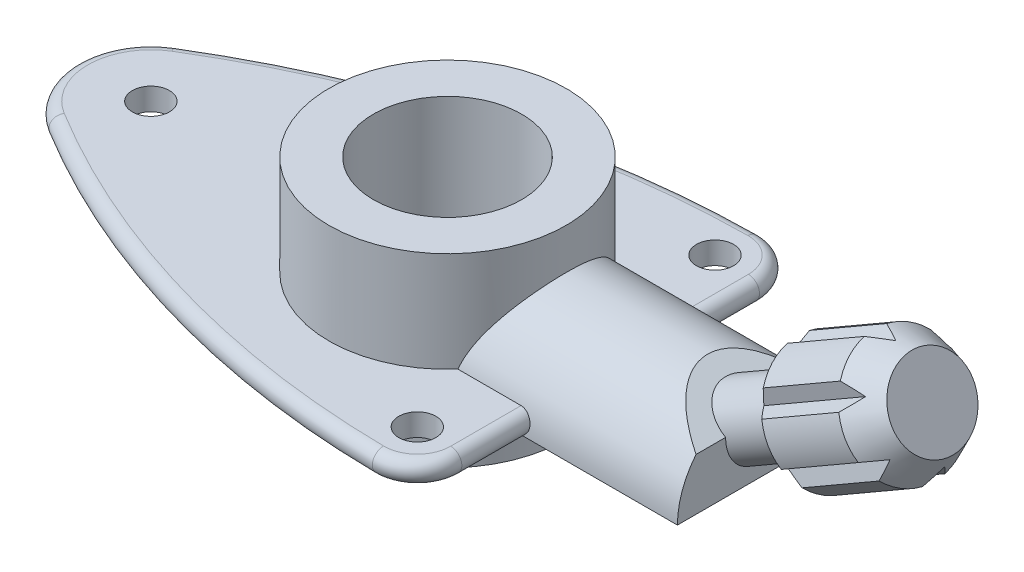
from build123d import *

# Parameters (mm, degrees)
SKETCH_5_R                                 = 2.5
SKETCH_5_R_2                               = 16
EXTRUDE_4_DEPTH                            = 1.5
EXTRUDE_5_DEPTH                            = 15
EXTRUDE_5_DEPTH_BACK                       = 10
SKETCH_5_5_R                               = 16
SKETCH_5_5_R_2                             = 10
EXTRUDE_8_REACH                            = 102.349
EXTRUDE_8_END_RADIUS                       = 16
EXTRUDE_START                              = 42
FILLET_3_R                                 = 1.5
CUT_EXTRUDE_1_DEPTH                        = 59.349404868
CUT_EXTRUDE_1_DEPTH_BACK                   = 59.349404868
SKETCH_12_R                                = 4.5
EXTRUDE_10_DEPTH                           = 27
EXTRUDE_10_DIRECTION_2_REACH               = 95.68
EXTRUDE_10_DIRECTION_2_OFFSET_FROM_SURFACE = 1
CUT_EXTRUDE_2_REACH                        = 120.489


with BuildPart() as part:
    # 草图5 → 凸台-拉伸4 (new, symmetric)
    with BuildSketch(Plane(origin=(0, 0, 0), x_dir=(1, 0, 0), z_dir=(0, 1, 0))):
        with BuildLine():
            Line((22, 12.901198358), (22, 20.070155931))
            ThreePointArc((22, 20.070155931), (20.219165167, 24.336142956), (15.933784902, 26.06979055))
            ThreePointArc((15.933784902, 26.06979055), (-15.818395827, 21.428501684), (-45.205280625, 8.538445621))
            ThreePointArc((-45.205280625, 8.538445621), (-50, 0), (-45.205280625, -8.538445621))
            ThreePointArc((-45.205280625, -8.538445621), (-15.818395827, -21.428501684), (15.933784902, -26.06979055))
            ThreePointArc((15.933784902, -26.06979055), (20.219165167, -24.336142956), (22, -20.070155931))
            Line((22, -20.070155931), (22, -12.901198358))
            Line((22, -12.901198358), (22, 12.901198358))
        make_face()
        with Locations(Location((-40, 0, 0), (0, 0, 270))):
            Circle(SKETCH_5_R, mode=Mode.SUBTRACT)
        with Locations(Location((16, -20.070155931, 0), (0, 0, 270))):
            Circle(SKETCH_5_R, mode=Mode.SUBTRACT)
        with Locations(Location((0, 0, 0), (0, 0, 270))):
            Circle(SKETCH_5_R_2, mode=Mode.SUBTRACT)
        with Locations(Location((16, 20.070155931, 0), (0, 0, 270))):
            Circle(SKETCH_5_R, mode=Mode.SUBTRACT)
    extrude(amount=EXTRUDE_4_DEPTH, both=True)

    # 草图5<5> → 凸台-拉伸5 (add, two sides: drawn at the far end of the back side and taken through both)
    with BuildSketch(Plane(origin=(0, 0, 0), x_dir=(1, 0, 0), z_dir=(0, 1, 0)).offset(-EXTRUDE_5_DEPTH_BACK)):
        with Locations(Location((0, 0, 0), (0, 0, 270))):
            Circle(SKETCH_5_5_R)
        with Locations(Location((0, 0, 0), (0, 0, 270))):
            Circle(SKETCH_5_5_R_2, mode=Mode.SUBTRACT)
    extrude(amount=EXTRUDE_5_DEPTH + EXTRUDE_5_DEPTH_BACK)

    # 凸台-拉伸8: up to this cylinder (the profile starts outside it)
    extrude_8_end = Plane(origin=(0, 3.168545, 0), z_dir=(0, -1, 0)) * Cylinder(EXTRUDE_8_END_RADIUS, 237.698, mode=Mode.PRIVATE)
    # 草图7 → 凸台-拉伸8 (add, up to the surface)
    with BuildSketch(Plane(origin=(0, 0, 0), x_dir=(0, 0, -1), z_dir=(1, 0, 0)).offset(EXTRUDE_START), mode=Mode.PRIVATE) as extrude_8_sk1:
        with BuildLine():
            ThreePointArc((11, -1.5), (7.778174593, 6.278174593), (0, 9.5))
            Line((0, 9.5), (0, -1.5))
            Line((0, -1.5), (11, -1.5))
        make_face()
    extrude_8_tool1 = extrude(extrude_8_sk1.sketch, amount=-EXTRUDE_8_REACH, mode=Mode.PRIVATE) - extrude_8_end
    add(extrude_8_tool1.solids().sort_by_distance((42, 3.168545, -4.668545))[0])
    # 草图7 → 凸台-拉伸8 (add, up to the surface)
    with BuildSketch(Plane(origin=(0, 0, 0), x_dir=(0, 0, -1), z_dir=(1, 0, 0)).offset(EXTRUDE_START), mode=Mode.PRIVATE) as extrude_8_sk2:
        with BuildLine():
            Line((0, -1.5), (0, 9.5))
            ThreePointArc((0, 9.5), (-7.778174593, 6.278174593), (-11, -1.5))
            Line((-11, -1.5), (0, -1.5))
        make_face()
    extrude_8_tool2 = extrude(extrude_8_sk2.sketch, amount=-EXTRUDE_8_REACH, mode=Mode.PRIVATE) - extrude_8_end
    add(extrude_8_tool2.solids().sort_by_distance((42, 3.168545, 4.668545))[0])
    # 草图7 → 凸台-拉伸8 (add, up to the surface)
    with BuildSketch(Plane(origin=(0, 0, 0), x_dir=(0, 0, -1), z_dir=(1, 0, 0)).offset(EXTRUDE_START), mode=Mode.PRIVATE) as extrude_8_sk3:
        with BuildLine():
            ThreePointArc((11, -1.5), (7.778174593, 6.278174593), (0, 9.5))
            Line((0, 9.5), (0, -1.5))
            Line((0, -1.5), (11, -1.5))
        make_face()
    extrude_8_tool3 = extrude(extrude_8_sk3.sketch, amount=-EXTRUDE_8_REACH, mode=Mode.PRIVATE) - extrude_8_end
    add(extrude_8_tool3.solids().sort_by_distance((42, 3.168545, -4.668545))[0])
    # 草图7 → 凸台-拉伸8 (add, up to the surface)
    with BuildSketch(Plane(origin=(0, 0, 0), x_dir=(0, 0, -1), z_dir=(1, 0, 0)).offset(EXTRUDE_START), mode=Mode.PRIVATE) as extrude_8_sk4:
        with BuildLine():
            Line((0, -1.5), (0, 9.5))
            ThreePointArc((0, 9.5), (-7.778174593, 6.278174593), (-11, -1.5))
            Line((-11, -1.5), (0, -1.5))
        make_face()
    extrude_8_tool4 = extrude(extrude_8_sk4.sketch, amount=-EXTRUDE_8_REACH, mode=Mode.PRIVATE) - extrude_8_end
    add(extrude_8_tool4.solids().sort_by_distance((42, 3.168545, 4.668545))[0])

    # 圆角3
    # the kernel refuses this fillet: 1.5 mm, written as the material it adds along each edge
    # the kernel refuses this fillet: 1.5 mm, written as the material it takes off along each edge
    with BuildSketch(Plane(origin=(16, -1.5, -20.070155931), x_dir=(1, 0, 0), z_dir=(0, 0, 1))) as fillet_3_2_piece_1:
        with BuildLine():
            CenterArc((6 - FILLET_3_R, FILLET_3_R), FILLET_3_R, 270, 90)
            Line((6 - FILLET_3_R, 0), (6, 0))
            Line((6, 0), (6, FILLET_3_R))
        make_face()
    revolve(axis=Axis((16, -1.5, -20.070155931), (0, 1, 0)), revolution_arc=90.632320449, mode=Mode.SUBTRACT)
    with BuildSketch(Plane(origin=(22, -1.5, 7.25), x_dir=(0, 1, 0), z_dir=(0, 0, 1))) as fillet_3_2_piece_2_section:
        with BuildLine():
            CenterArc((FILLET_3_R, FILLET_3_R), FILLET_3_R, 180, 90)
            Line((0, FILLET_3_R), (0, 0))
            Line((0, 0), (FILLET_3_R, 0))
        make_face()
    fillet_3_2_piece_2 = extrude(amount=12.820155931, mode=Mode.PRIVATE)
    fillet_3_2_piece_2 = fillet_3_2_piece_2 - Plane(origin=(21.695873308, -1.5, 0), x_dir=(0, 0, -1), z_dir=(1, 0, 0)) * Cylinder(11, 32, mode=Mode.PRIVATE)
    add(fillet_3_2_piece_2, mode=Mode.SUBTRACT)
    with BuildSketch(Plane(origin=(16, -1.5, 20.070155931), x_dir=(-0.0110358497416669, 0, 0.9999391031560269), z_dir=(-0.9999391031560269, 0, -0.0110358497416669))) as fillet_3_2_piece_3:
        with BuildLine():
            CenterArc((6 - FILLET_3_R, FILLET_3_R), FILLET_3_R, 270, 90)
            Line((6 - FILLET_3_R, 0), (6, 0))
            Line((6, 0), (6, FILLET_3_R))
        make_face()
    revolve(axis=Axis((16, -1.5, 20.070155931), (0, 1, 0)), revolution_arc=90.632320449, mode=Mode.SUBTRACT)
    with BuildSketch(Plane(origin=(17.258086871, -1.5, -93.922901829), x_dir=(-0.5205280624595463, 0, 0.8538445620791356), z_dir=(-0.8538445620791356, 0, -0.5205280624595463))) as fillet_3_2_piece_4:
        with BuildLine():
            CenterArc((120 - FILLET_3_R, FILLET_3_R), FILLET_3_R, 270, 90)
            Line((120 - FILLET_3_R, 0), (120, 0))
            Line((120, 0), (120, FILLET_3_R))
        make_face()
    revolve(axis=Axis((17.258086871, -1.5, -93.922901829), (0, 1, 0)), revolution_arc=30.735359102, mode=Mode.SUBTRACT)
    with BuildSketch(Plane(origin=(-40, -1.5, 0), x_dir=(-0.5205280624595499, 0, -0.8538445620791334), z_dir=(0.8538445620791334, 0, -0.5205280624595499))) as fillet_3_2_piece_5:
        with BuildLine():
            CenterArc((10 - FILLET_3_R, FILLET_3_R), FILLET_3_R, 270, 90)
            Line((10 - FILLET_3_R, 0), (10, 0))
            Line((10, 0), (10, FILLET_3_R))
        make_face()
    revolve(axis=Axis((-40, -1.5, 0), (0, 1, 0)), revolution_arc=117.264640898, mode=Mode.SUBTRACT)
    with BuildSketch(Plane(origin=(17.258086871, -1.5, 93.922901829), x_dir=(-0.011035849741673097, 0, -0.9999391031560269), z_dir=(0.9999391031560269, 0, -0.011035849741673097))) as fillet_3_2_piece_6:
        with BuildLine():
            CenterArc((120 - FILLET_3_R, FILLET_3_R), FILLET_3_R, 270, 90)
            Line((120 - FILLET_3_R, 0), (120, 0))
            Line((120, 0), (120, FILLET_3_R))
        make_face()
    revolve(axis=Axis((17.258086871, -1.5, 93.922901829), (0, 1, 0)), revolution_arc=30.735359102, mode=Mode.SUBTRACT)
    with BuildSketch(Plane(origin=(17.258086871, 1.5, 93.922901829), x_dir=(-0.011035849741673097, 0, -0.9999391031560269), z_dir=(0.9999391031560269, 0, -0.011035849741673097))) as fillet_3_2_piece_7:
        with BuildLine():
            CenterArc((120 - FILLET_3_R, -FILLET_3_R), FILLET_3_R, 0, 90)
            Line((120 - FILLET_3_R, 0), (120, 0))
            Line((120, 0), (120, -FILLET_3_R))
        make_face()
    revolve(axis=Axis((17.258086871, 1.5, 93.922901829), (0, 1, 0)), revolution_arc=30.735359102, mode=Mode.SUBTRACT)
    with BuildSketch(Plane(origin=(-40, 1.5, 0), x_dir=(-0.5205280624595499, 0, -0.8538445620791334), z_dir=(0.8538445620791334, 0, -0.5205280624595499))) as fillet_3_2_piece_8:
        with BuildLine():
            CenterArc((10 - FILLET_3_R, -FILLET_3_R), FILLET_3_R, 0, 90)
            Line((10 - FILLET_3_R, 0), (10, 0))
            Line((10, 0), (10, -FILLET_3_R))
        make_face()
    revolve(axis=Axis((-40, 1.5, 0), (0, 1, 0)), revolution_arc=117.264640898, mode=Mode.SUBTRACT)
    with BuildSketch(Plane(origin=(17.258086871, 1.5, -93.922901829), x_dir=(-0.5205280624595463, 0, 0.8538445620791356), z_dir=(-0.8538445620791356, 0, -0.5205280624595463))) as fillet_3_2_piece_9:
        with BuildLine():
            CenterArc((120 - FILLET_3_R, -FILLET_3_R), FILLET_3_R, 0, 90)
            Line((120, -FILLET_3_R), (120, 0))
            Line((120, 0), (120 - FILLET_3_R, 0))
        make_face()
    revolve(axis=Axis((17.258086871, 1.5, -93.922901829), (0, 1, 0)), revolution_arc=30.735359102, mode=Mode.SUBTRACT)
    with BuildSketch(Plane(origin=(22, -1.5, -20.070155931), x_dir=(0, 1, 0), z_dir=(0, 0, 1))) as fillet_3_2_piece_10_section:
        with BuildLine():
            CenterArc((FILLET_3_R, FILLET_3_R), FILLET_3_R, 180, 90)
            Line((0, FILLET_3_R), (0, 0))
            Line((0, 0), (FILLET_3_R, 0))
        make_face()
    fillet_3_2_piece_10 = extrude(amount=12.820155931, mode=Mode.PRIVATE)
    fillet_3_2_piece_10 = fillet_3_2_piece_10 - Plane(origin=(21.695873079, -1.5, 0), x_dir=(0, 0, -1), z_dir=(1, 0, 0)) * Cylinder(11, 32, mode=Mode.PRIVATE)
    add(fillet_3_2_piece_10, mode=Mode.SUBTRACT)
    with BuildSketch(Plane(origin=(22, 1.5, -6.833005244), x_dir=(0, -1, 0), z_dir=(0, 0, -1))) as fillet_3_2_piece_11_section:
        with BuildLine():
            CenterArc((FILLET_3_R, FILLET_3_R), FILLET_3_R, 180, 90)
            Line((0, FILLET_3_R), (0, 0))
            Line((0, 0), (FILLET_3_R, 0))
        make_face()
    fillet_3_2_piece_11 = extrude(amount=13.237150687, mode=Mode.PRIVATE)
    fillet_3_2_piece_11 = fillet_3_2_piece_11 - Plane(origin=(21.692857853, -1.5, 0), x_dir=(0, 0, -1), z_dir=(1, 0, 0)) * Cylinder(11, 33, mode=Mode.PRIVATE)
    add(fillet_3_2_piece_11, mode=Mode.SUBTRACT)
    with BuildSketch(Plane(origin=(16, 1.5, 20.070155931), x_dir=(-0.0110358497416669, 0, 0.9999391031560269), z_dir=(-0.9999391031560269, 0, -0.0110358497416669))) as fillet_3_2_piece_12:
        with BuildLine():
            CenterArc((6 - FILLET_3_R, -FILLET_3_R), FILLET_3_R, 0, 90)
            Line((6 - FILLET_3_R, 0), (6, 0))
            Line((6, 0), (6, -FILLET_3_R))
        make_face()
    revolve(axis=Axis((16, 1.5, 20.070155931), (0, 1, 0)), revolution_arc=90.632320449, mode=Mode.SUBTRACT)
    with BuildSketch(Plane(origin=(22, 1.5, 20.070155931), x_dir=(0, -1, 0), z_dir=(0, 0, -1))) as fillet_3_2_piece_13_section:
        with BuildLine():
            CenterArc((FILLET_3_R, FILLET_3_R), FILLET_3_R, 180, 90)
            Line((0, FILLET_3_R), (0, 0))
            Line((0, 0), (FILLET_3_R, 0))
        make_face()
    fillet_3_2_piece_13 = extrude(amount=13.237150687, mode=Mode.PRIVATE)
    fillet_3_2_piece_13 = fillet_3_2_piece_13 - Plane(origin=(21.692857203, -1.5, 0), x_dir=(0, 0, -1), z_dir=(1, 0, 0)) * Cylinder(11, 33, mode=Mode.PRIVATE)
    add(fillet_3_2_piece_13, mode=Mode.SUBTRACT)
    with BuildSketch(Plane(origin=(16, 1.5, -20.070155931), x_dir=(1, 0, 0), z_dir=(0, 0, 1))) as fillet_3_2_piece_14:
        with BuildLine():
            CenterArc((6 - FILLET_3_R, -FILLET_3_R), FILLET_3_R, 0, 90)
            Line((6 - FILLET_3_R, 0), (6, 0))
            Line((6, 0), (6, -FILLET_3_R))
        make_face()
    revolve(axis=Axis((16, 1.5, -20.070155931), (0, 1, 0)), revolution_arc=90.632320449, mode=Mode.SUBTRACT)

    # 草图10 → 切除-拉伸1 (cut, two sides: drawn at the far end of the back side and taken through both)
    with BuildSketch(Plane.XY.offset(-CUT_EXTRUDE_1_DEPTH_BACK)):
        Polygon((-135.182857094, 107.796570239), (35.07179677, 9.5), (42, 5.5), (212.254653864, -92.796570239), (408.847794342, 247.712737489), (61.410283384, 448.305877967), align=None)
    extrude(amount=CUT_EXTRUDE_1_DEPTH + CUT_EXTRUDE_1_DEPTH_BACK, mode=Mode.SUBTRACT)

    # 草图12 → 凸台-拉伸10 (add)
    with BuildSketch(Plane(origin=(33.88156986, 19.561533479, 0), x_dir=(0, 0, -1), z_dir=(0.8660254037844398, 0.499999999999998, 0))):
        with Locations(Location((0, -16.236860279, 0), (0, 0, 90))):
            Circle(SKETCH_12_R)
    extrude(amount=EXTRUDE_10_DEPTH)

    # 凸台-拉伸10 direction 2: up to this face of the body (flat: up to its plane, moved by the offset)
    extrude_10_direction_2_end = Plane(part.part.faces().sort_by_distance((19.47019321, -1.5, -15.535077966))[0]).offset(-EXTRUDE_10_DIRECTION_2_OFFSET_FROM_SURFACE)
    # 草图12 → 凸台-拉伸10 direction 2 (add, up to the picked face)
    with BuildSketch(Plane(origin=(33.88156986, 19.561533479, 0), x_dir=(0, 0, -1), z_dir=(0.8660254037844398, 0.499999999999998, 0)), mode=Mode.PRIVATE) as extrude_10_direction_2_sk1:
        with Locations(Location((0, -16.236860279, 0), (0, 0, 90))):
            Circle(SKETCH_12_R)
    extrude_10_direction_2_tool1 = split(extrude(extrude_10_direction_2_sk1.sketch, amount=-EXTRUDE_10_DIRECTION_2_REACH, mode=Mode.PRIVATE), bisect_by=extrude_10_direction_2_end, keep=Keep.BOTH, mode=Mode.PRIVATE)
    add(extrude_10_direction_2_tool1.solids().sort_by(Axis((42, 5.5, 0), (-0.8660254037844398, -0.499999999999998, 0)))[0])

    # 草图14 → 旋转1 (revolve)
    with BuildSketch(Plane.XY):
        Polygon((45.959292144, 12.982050808), (47.240381057, 17.763139721), (57.632685902, 23.763139721), (62.632685902, 23.763139721), (63.132685902, 22.897114317), align=None)
    revolve(axis=Axis((14.207613987, -10.545941546, 0), (0.8660254037844398, 0.49999999999999806, 0)))

    # 草图15 → 切除-拉伸2 (cut, up to next)
    with BuildSketch(Plane(origin=(57.264255763, 33.061533479, 0), x_dir=(0, 0, -1), z_dir=(0.8660254037844398, 0.49999999999999806, 0)), mode=Mode.PRIVATE) as cut_extrude_2_sk1:
        with BuildLine():
            Line((-1.5, -8.378743456), (0, -9.637392903))
            Line((0, -9.637392903), (1.5, -8.378743456))
            ThreePointArc((1.5, -8.378743456), (0, -8.236860279), (-1.5, -8.378743456))
        make_face()
    cut_extrude_2_tool1 = extrude(cut_extrude_2_sk1.sketch, amount=-CUT_EXTRUDE_2_REACH, mode=Mode.PRIVATE) & part.part
    # 草图15 → 切除-拉伸2 (cut, up to next)
    with BuildSketch(Plane(origin=(57.264255763, 33.061533479, 0), x_dir=(0, 0, -1), z_dir=(0.8660254037844398, 0.49999999999999806, 0)), mode=Mode.PRIVATE) as cut_extrude_2_sk2:
        with BuildLine():
            Line((5.715306399, -12.937126591), (7.555328794, -13.606839973))
            ThreePointArc((7.555328794, -13.606839973), (6.92820323, -12.236860279), (6.055328794, -11.008763762))
            Line((6.055328794, -11.008763762), (5.715306399, -12.937126591))
        make_face()
    cut_extrude_2_tool2 = extrude(cut_extrude_2_sk2.sketch, amount=-CUT_EXTRUDE_2_REACH, mode=Mode.PRIVATE) & part.part
    # 草图15 → 切除-拉伸2 (cut, up to next)
    with BuildSketch(Plane(origin=(57.264255763, 33.061533479, 0), x_dir=(0, 0, -1), z_dir=(0.8660254037844398, 0.49999999999999806, 0)), mode=Mode.PRIVATE) as cut_extrude_2_sk3:
        with BuildLine():
            Line((5.715306399, -19.536593967), (6.055328794, -21.464956796))
            ThreePointArc((6.055328794, -21.464956796), (6.92820323, -20.236860279), (7.555328794, -18.866880585))
            Line((7.555328794, -18.866880585), (5.715306399, -19.536593967))
        make_face()
    cut_extrude_2_tool3 = extrude(cut_extrude_2_sk3.sketch, amount=-CUT_EXTRUDE_2_REACH, mode=Mode.PRIVATE) & part.part
    # 草图15 → 切除-拉伸2 (cut, up to next)
    with BuildSketch(Plane(origin=(57.264255763, 33.061533479, 0), x_dir=(0, 0, -1), z_dir=(0.8660254037844398, 0.49999999999999806, 0)), mode=Mode.PRIVATE) as cut_extrude_2_sk4:
        with BuildLine():
            Line((0, -22.836327655), (-1.5, -24.094977102))
            ThreePointArc((-1.5, -24.094977102), (0, -24.236860279), (1.5, -24.094977102))
            Line((1.5, -24.094977102), (0, -22.836327655))
        make_face()
    cut_extrude_2_tool4 = extrude(cut_extrude_2_sk4.sketch, amount=-CUT_EXTRUDE_2_REACH, mode=Mode.PRIVATE) & part.part
    # 草图15 → 切除-拉伸2 (cut, up to next)
    with BuildSketch(Plane(origin=(57.264255763, 33.061533479, 0), x_dir=(0, 0, -1), z_dir=(0.8660254037844398, 0.49999999999999806, 0)), mode=Mode.PRIVATE) as cut_extrude_2_sk5:
        with BuildLine():
            Line((-5.715306399, -19.536593967), (-7.555328794, -18.866880585))
            ThreePointArc((-7.555328794, -18.866880585), (-6.92820323, -20.236860279), (-6.055328794, -21.464956796))
            Line((-6.055328794, -21.464956796), (-5.715306399, -19.536593967))
        make_face()
    cut_extrude_2_tool5 = extrude(cut_extrude_2_sk5.sketch, amount=-CUT_EXTRUDE_2_REACH, mode=Mode.PRIVATE) & part.part
    # 草图15 → 切除-拉伸2 (cut, up to next)
    with BuildSketch(Plane(origin=(57.264255763, 33.061533479, 0), x_dir=(0, 0, -1), z_dir=(0.8660254037844398, 0.49999999999999806, 0)), mode=Mode.PRIVATE) as cut_extrude_2_sk6:
        with BuildLine():
            Line((-5.715306399, -12.937126591), (-6.055328794, -11.008763762))
            ThreePointArc((-6.055328794, -11.008763762), (-6.92820323, -12.236860279), (-7.555328794, -13.606839973))
            Line((-7.555328794, -13.606839973), (-5.715306399, -12.937126591))
        make_face()
    cut_extrude_2_tool6 = extrude(cut_extrude_2_sk6.sketch, amount=-CUT_EXTRUDE_2_REACH, mode=Mode.PRIVATE) & part.part
    add(cut_extrude_2_tool1.solids().sort_by_distance((61.632234, 25.495974, 0))[0], mode=Mode.SUBTRACT)
    add(cut_extrude_2_tool2.solids().sort_by_distance((63.50746, 22.247987, -6.495974))[0], mode=Mode.SUBTRACT)
    add(cut_extrude_2_tool3.solids().sort_by_distance((67.257912, 15.752013, -6.495974))[0], mode=Mode.SUBTRACT)
    add(cut_extrude_2_tool4.solids().sort_by_distance((69.133138, 12.504026, 0))[0], mode=Mode.SUBTRACT)
    add(cut_extrude_2_tool5.solids().sort_by_distance((67.257912, 15.752013, 6.495974))[0], mode=Mode.SUBTRACT)
    add(cut_extrude_2_tool6.solids().sort_by_distance((63.50746, 22.247987, 6.495974))[0], mode=Mode.SUBTRACT)


solid = part.part
